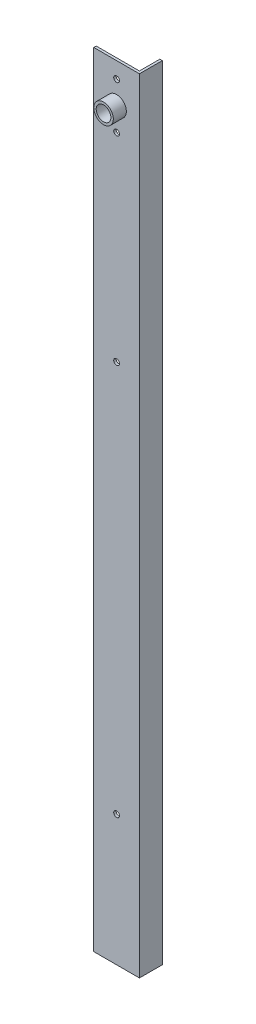
from build123d import *

# Parameters (mm, degrees)
SKETCH1_W           = 88.9
SKETCH1_H           = 44.45
BOSS_EXTRUDE1_DEPTH = 1524
CUT_EXTRUDE1_REACH  = 1527.296
SKETCH2_R           = 7.9375
SKETCH2_R_2         = 5.588
SKETCH4_R           = 19.05
SKETCH4_R_2         = 14.2875
BOSS_EXTRUDE2_DEPTH = 25.4
CUT_EXTRUDE2_REACH  = 1527.392
SKETCH6_W           = 88.9
SKETCH6_H           = 44.45
BOSS_EXTRUDE3_DEPTH = 6.35
SKETCH7_R           = 5.588
CUT_EXTRUDE3_DEPTH  = 1526.295907357


with BuildPart() as part:
    # Sketch1 → Boss-Extrude1 (new body)
    with BuildSketch(Plane(origin=(0, 0, 0), x_dir=(1, 0, 0), z_dir=(0, 1, 0))):
        Rectangle(SKETCH1_W, SKETCH1_H)
    extrude(amount=BOSS_EXTRUDE1_DEPTH)

    # Sketch2 → Cut-Extrude1 (cut, up to next)
    with BuildSketch(Plane.XY.offset(22.225), mode=Mode.PRIVATE) as cut_extrude1_sk1:
        with Locations((0, 1447.8)):
            Circle(SKETCH2_R)
    cut_extrude1_tool1 = extrude(cut_extrude1_sk1.sketch, amount=-CUT_EXTRUDE1_REACH, mode=Mode.PRIVATE) & part.part
    # Sketch2 → Cut-Extrude1 (cut, up to next)
    with BuildSketch(Plane.XY.offset(22.225), mode=Mode.PRIVATE) as cut_extrude1_sk2:
        with Locations((0, 1492.8453125)):
            Circle(SKETCH2_R_2)
    cut_extrude1_tool2 = extrude(cut_extrude1_sk2.sketch, amount=-CUT_EXTRUDE1_REACH, mode=Mode.PRIVATE) & part.part
    # Sketch2 → Cut-Extrude1 (cut, up to next)
    with BuildSketch(Plane.XY.offset(22.225), mode=Mode.PRIVATE) as cut_extrude1_sk3:
        with Locations((0, 1402.7546875)):
            Circle(SKETCH2_R_2)
    cut_extrude1_tool3 = extrude(cut_extrude1_sk3.sketch, amount=-CUT_EXTRUDE1_REACH, mode=Mode.PRIVATE) & part.part
    add(cut_extrude1_tool1.solids().sort_by_distance((0, 1447.8, 22.225))[0], mode=Mode.SUBTRACT)
    add(cut_extrude1_tool2.solids().sort_by_distance((0, 1492.845313, 22.225))[0], mode=Mode.SUBTRACT)
    add(cut_extrude1_tool3.solids().sort_by_distance((0, 1402.754688, 22.225))[0], mode=Mode.SUBTRACT)

    # Sketch4 → Boss-Extrude2 (add)
    with BuildSketch(Plane.XY.offset(22.225)):
        with Locations((0, 1447.8)):
            Circle(SKETCH4_R)
        with Locations((0, 1447.8)):
            Circle(SKETCH4_R_2, mode=Mode.SUBTRACT)
    extrude(amount=BOSS_EXTRUDE2_DEPTH)

    # Sketch5 → Cut-Extrude2 (cut, up to next)
    with BuildSketch(Plane(origin=(0, 1524, 0), x_dir=(1, 0, 0), z_dir=(0, 1, 0)), mode=Mode.PRIVATE) as cut_extrude2_sk1:
        Polygon((39.6875, 17.4625), (39.6875, 22.225), (-44.45, 22.225), (-44.45, -17.4625), (-39.6875, -17.4625), (39.6875, -17.4625), align=None)
    cut_extrude2_tool1 = extrude(cut_extrude2_sk1.sketch, amount=-CUT_EXTRUDE2_REACH, mode=Mode.PRIVATE) & part.part
    add(cut_extrude2_tool1.solids().sort_by_distance((-2.38125, 1524, -2.38125))[0], mode=Mode.SUBTRACT)

    # Sketch6 → Boss-Extrude3 (add)
    with BuildSketch(Plane.XZ):
        Rectangle(SKETCH6_W, SKETCH6_H)
    extrude(amount=-BOSS_EXTRUDE3_DEPTH)

    # Sketch7 → Cut-Extrude3 (cut, through all)
    with BuildSketch(Plane.XY.offset(22.225)):
        with Locations((0, 1016)):
            Circle(SKETCH7_R)
        with Locations((0, 254)):
            Circle(SKETCH7_R)
    extrude(amount=-CUT_EXTRUDE3_DEPTH, mode=Mode.SUBTRACT)


solid = part.part
